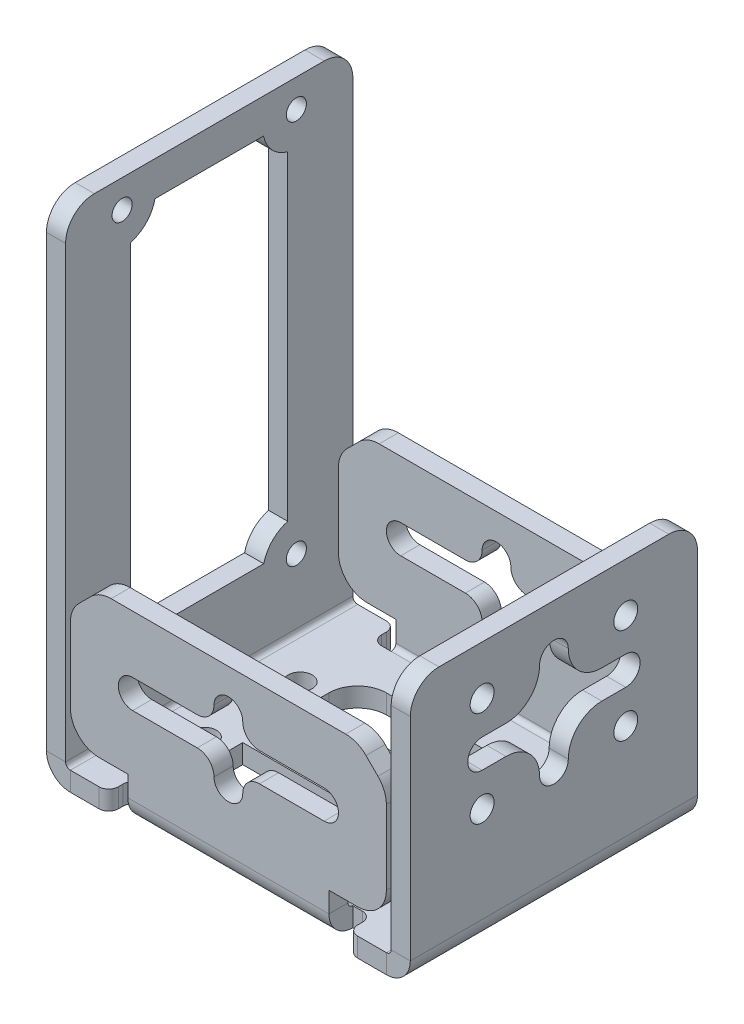
from build123d import *

# Parameters (mm, degrees)
BRIDA_BASE1_DEPTH               = 2
BRIDA_DE_ARISTA1_DEPTH          = 30
BRIDA_DE_ARISTA2_DEPTH          = 30
PLIEGUE_START                   = -16.5
PLIEGUE_CROQUIZADO2_OUTLINE_W   = 2
PLIEGUE_CROQUIZADO2_OUTLINE_H   = 15
PLIEGUE_CROQUIZADO2_DEPTH       = 33
PLIEGUE_START_2                 = -10.5
PLIEGUE_CROQUIZADO2_2_DEPTH     = 21
PLIEGUE_CROQUIZADO2_3_OUTLINE_W = 15
PLIEGUE_CROQUIZADO2_3_OUTLINE_H = 2
PLIEGUE_CROQUIZADO2_3_DEPTH     = 33
PLIEGUE_CROQUIZADO2_4_DEPTH     = 21
PLIEGUE_CROQUIZADO3_OUTLINE_W   = 2
PLIEGUE_CROQUIZADO3_OUTLINE_H   = 15
PLIEGUE_CROQUIZADO3_DEPTH       = 33
PLIEGUE_CROQUIZADO3_2_DEPTH     = 21
PLIEGUE_CROQUIZADO3_3_OUTLINE_W = 15
PLIEGUE_CROQUIZADO3_3_OUTLINE_H = 2
PLIEGUE_CROQUIZADO3_3_DEPTH     = 33
PLIEGUE_CROQUIZADO3_4_DEPTH     = 21
CROQUIS14_R                     = 1.05
CORTAR_EXTRUIR1_DEPTH           = 10
REDONDEO1_R                     = 3
CROQUIS15_R                     = 1.25
CORTAR_EXTRUIR2_DEPTH           = 2
CROQUIS16_R                     = 1.25
CORTAR_EXTRUIR3_DEPTH           = 2
CORTAR_EXTRUIR4_DEPTH           = 62.653548154


# Read off the part's stored shape, not the designer's step: Pliegue croquizado2, Pliegue croquizado3
# Sheet-metal steps are written as plain solids
with BuildPart() as part:
    # Croquis base → Brida base1 (new body)
    with BuildSketch(Plane(origin=(0, 0, 0), x_dir=(1, 0, 0), z_dir=(0, 1, 0))):
        with BuildLine():
            Line((-16.5, 15), (-16.5, -15))
            Line((-16.5, -15), (-13.5, -15))
            ThreePointArc((-13.5, -15), (-12.792893219, -14.707106781), (-12.5, -14))
            Line((-12.5, -14), (-12.5, -13.5))
            ThreePointArc((-12.5, -13.5), (-12.207106781, -12.792893219), (-11.5, -12.5))
            Line((-11.5, -12.5), (-10.5, -12.5))
            Line((-10.5, -12.5), (-10.5, -15))
            Line((-10.5, -15), (-10.5, -17))
            Line((-10.5, -17), (-16.5, -17))
            Line((-16.5, -17), (-16.5, -32))
            Line((-16.5, -32), (16.5, -32))
            Line((16.5, -32), (16.5, -17))
            Line((16.5, -17), (10.5, -17))
            Line((10.5, -17), (10.5, -15))
            Line((10.5, -15), (10.5, -12.5))
            Line((10.5, -12.5), (11.5, -12.5))
            ThreePointArc((11.5, -12.5), (12.207106781, -12.792893219), (12.5, -13.5))
            Line((12.5, -13.5), (12.5, -14))
            ThreePointArc((12.5, -14), (12.792893219, -14.707106781), (13.5, -15))
            Line((13.5, -15), (16.5, -15))
            Line((16.5, -15), (16.5, 15))
            Line((16.5, 15), (13.5, 15))
            ThreePointArc((13.5, 15), (12.792893219, 14.707106781), (12.5, 14))
            Line((12.5, 14), (12.5, 13.5))
            ThreePointArc((12.5, 13.5), (12.207106781, 12.792893219), (11.5, 12.5))
            Line((11.5, 12.5), (10.5, 12.5))
            Line((10.5, 12.5), (10.5, 15))
            Line((10.5, 15), (10.5, 17))
            Line((10.5, 17), (16.5, 17))
            Line((16.5, 17), (16.5, 32))
            Line((16.5, 32), (-16.5, 32))
            Line((-16.5, 32), (-16.5, 17))
            Line((-16.5, 17), (-10.5, 17))
            Line((-10.5, 17), (-10.5, 15))
            Line((-10.5, 15), (-10.5, 12.5))
            Line((-10.5, 12.5), (-11.5, 12.5))
            ThreePointArc((-11.5, 12.5), (-12.207106781, 12.792893219), (-12.5, 13.5))
            Line((-12.5, 13.5), (-12.5, 14))
            ThreePointArc((-12.5, 14), (-12.792893219, 14.707106781), (-13.5, 15))
            Line((-13.5, 15), (-16.5, 15))
        make_face()
    extrude(amount=-BRIDA_BASE1_DEPTH)

    # Brida de arista1 section (across the edge) → Brida de arista1 (add)
    with BuildSketch(Plane(origin=(-17, 0, -15), x_dir=(1, 0, 0), z_dir=(0, 0, 1))):
        with BuildLine():
            Line((-2, 0.5), (-2, 50.4))
            Line((-2, 50.4), (0, 50.4))
            Line((0, 50.4), (0, 0.5))
            ThreePointArc((0, 0.5), (0.146446609, 0.146446609), (0.5, 0))
            Line((0.5, 0), (0.5, -2))
            ThreePointArc((0.5, -2), (-1.267766953, -1.267766953), (-2, 0.5))
        make_face()
    extrude(amount=BRIDA_DE_ARISTA1_DEPTH)

    # Brida de arista2 section (across the edge) → Brida de arista2 (add)
    with BuildSketch(Plane(origin=(17, 0, 15), x_dir=(-1, 0, 0), z_dir=(0, 0, -1))):
        with BuildLine():
            Line((-2, 0.5), (-2, 25.6))
            Line((-2, 25.6), (0, 25.6))
            Line((0, 25.6), (0, 0.5))
            ThreePointArc((0, 0.5), (0.146446609, 0.146446609), (0.5, 0))
            Line((0.5, 0), (0.5, -2))
            ThreePointArc((0.5, -2), (-1.267766953, -1.267766953), (-2, 0.5))
        make_face()
    extrude(amount=BRIDA_DE_ARISTA2_DEPTH)

    # Pliegue croquizado2 outline → Pliegue croquizado2 (cut)
    with BuildSketch(Plane.YZ.offset(PLIEGUE_START)):
        with Locations((-1, -24.5)):
            Rectangle(PLIEGUE_CROQUIZADO2_OUTLINE_W, PLIEGUE_CROQUIZADO2_OUTLINE_H)
    extrude(amount=PLIEGUE_CROQUIZADO2_DEPTH, mode=Mode.SUBTRACT)

    # Pliegue croquizado2 2 outline → Pliegue croquizado2 2 (cut)
    with BuildSketch(Plane.YZ.offset(PLIEGUE_START_2)):
        with BuildLine():
            Line((0, -17), (0, -14.949489743))
            ThreePointArc((0, -14.949489743), (-1.436491673, -14.08113883), (-2, -12.5))
            Line((-2, -12.5), (-2, -17))
            Line((-2, -17), (0, -17))
        make_face()
    extrude(amount=PLIEGUE_CROQUIZADO2_2_DEPTH, mode=Mode.SUBTRACT)



with BuildPart() as body_2:
    # Pliegue croquizado2 3 outline → Pliegue croquizado2 3 (new body)
    with BuildSketch(Plane.YZ.offset(PLIEGUE_START)):
        with Locations((10.14380551, -14)):
            Rectangle(PLIEGUE_CROQUIZADO2_3_OUTLINE_W, PLIEGUE_CROQUIZADO2_3_OUTLINE_H)
    extrude(amount=PLIEGUE_CROQUIZADO2_3_DEPTH)


with BuildPart() as part_1:
    add(part.part)

    add(body_2.part)  # Pliegue croquizado2 4 merges body 2
    # Pliegue croquizado2 4 outline → Pliegue croquizado2 4 (add)
    with BuildSketch(Plane.YZ.offset(PLIEGUE_START_2)):
        with BuildLine():
            Line((0.5, -15), (2.64380551, -15))
            Line((2.64380551, -15), (2.64380551, -13))
            Line((2.64380551, -13), (0.5, -13))
            ThreePointArc((0.5, -13), (0.146446609, -12.853553391), (0, -12.5))
            Line((0, -12.5), (0, -14.949489743))
            ThreePointArc((0, -14.949489743), (0.248727595, -14.987340383), (0.5, -15))
        make_face()
    extrude(amount=PLIEGUE_CROQUIZADO2_4_DEPTH)

    # Pliegue croquizado3 outline → Pliegue croquizado3 (cut)
    with BuildSketch(Plane.YZ.offset(PLIEGUE_START)):
        with Locations((-1, 24.5)):
            Rectangle(PLIEGUE_CROQUIZADO3_OUTLINE_W, PLIEGUE_CROQUIZADO3_OUTLINE_H)
    extrude(amount=PLIEGUE_CROQUIZADO3_DEPTH, mode=Mode.SUBTRACT)

    # Pliegue croquizado3 2 outline → Pliegue croquizado3 2 (cut)
    with BuildSketch(Plane.YZ.offset(PLIEGUE_START_2)):
        with BuildLine():
            ThreePointArc((-2, 12.5), (-1.436491673, 14.08113883), (0, 14.949489743))
            Line((0, 14.949489743), (0, 17))
            Line((0, 17), (-2, 17))
            Line((-2, 17), (-2, 12.5))
        make_face()
    extrude(amount=PLIEGUE_CROQUIZADO3_2_DEPTH, mode=Mode.SUBTRACT)



with BuildPart() as body_2_2:
    # Pliegue croquizado3 3 outline → Pliegue croquizado3 3 (new body)
    with BuildSketch(Plane.YZ.offset(PLIEGUE_START)):
        with Locations((10.14380551, 14)):
            Rectangle(PLIEGUE_CROQUIZADO3_3_OUTLINE_W, PLIEGUE_CROQUIZADO3_3_OUTLINE_H)
    extrude(amount=PLIEGUE_CROQUIZADO3_3_DEPTH)


with BuildPart() as part_2:
    add(part_1.part)

    add(body_2_2.part)  # Pliegue croquizado3 4 merges body 2 2
    # Pliegue croquizado3 4 outline → Pliegue croquizado3 4 (add)
    with BuildSketch(Plane.YZ.offset(PLIEGUE_START_2)):
        with BuildLine():
            Line((2.64380551, 15), (0.5, 15))
            ThreePointArc((0.5, 15), (0.248727595, 14.987340383), (0, 14.949489743))
            Line((0, 14.949489743), (0, 12.5))
            ThreePointArc((0, 12.5), (0.146446609, 12.853553391), (0.5, 13))
            Line((0.5, 13), (2.64380551, 13))
            Line((2.64380551, 13), (2.64380551, 15))
        make_face()
    extrude(amount=PLIEGUE_CROQUIZADO3_4_DEPTH)

    # Croquis14 → Cortar-Extruir1 (cut)
    with BuildSketch(Plane.ZY.offset(19)):
        with BuildLine():
            Line((5.67071436, 46.7745), (-5.67071436, 46.7745))
            ThreePointArc((-5.67071436, 46.7745), (-6.553557163, 45.073327603), (-8.2, 44.092193095))
            Line((-8.2, 44.092193095), (-8.2, 10.656806905))
            ThreePointArc((-8.2, 10.656806905), (-6.588947931, 9.712658631), (-5.692654993, 8.0745))
            Line((-5.692654993, 8.0745), (5.692654993, 8.0745))
            ThreePointArc((5.692654993, 8.0745), (6.588947931, 9.712658631), (8.2, 10.656806905))
            Line((8.2, 10.656806905), (8.2, 44.092193095))
            ThreePointArc((8.2, 44.092193095), (6.553557163, 45.073327603), (5.67071436, 46.7745))
        make_face()
        with Locations(Location((-9.1, 47.4745, 0), (0, 0, 270))):
            Circle(CROQUIS14_R)
        with Locations(Location((9.1, 47.4745, 0), (0, 0, 270))):
            Circle(CROQUIS14_R)
        with Locations(Location((9.1, 7.2745, 0), (0, 0, 270))):
            Circle(CROQUIS14_R)
        with Locations(Location((-9.1, 7.2745, 0), (0, 0, 270))):
            Circle(CROQUIS14_R)
    extrude(amount=-CORTAR_EXTRUIR1_DEPTH, mode=Mode.SUBTRACT)

    # Redondeo1
    redondeo1_edges = [part_2.edges().sort_by_distance(p)[0] for p in [
        (-18, 50.4, -15),
        (-18, 50.4, 15),
    ]]
    fillet(redondeo1_edges, radius=REDONDEO1_R)

    # Croquis15 → Cortar-Extruir2 (cut)
    with BuildSketch(Plane.XZ.offset(2)):
        with BuildLine():
            Line((7, 8.5), (-7, 8.5))
            ThreePointArc((-7, 8.5), (-9.121320344, 7.621320344), (-10, 5.5))
            Line((-10, 5.5), (-10, 3.5))
            Line((-10, 3.5), (10, 3.5))
            Line((10, 3.5), (10, 5.5))
            ThreePointArc((10, 5.5), (9.121320344, 7.621320344), (7, 8.5))
        make_face()
        with BuildLine():
            Line((10, -3.5), (-10, -3.5))
            Line((-10, -3.5), (-10, -5.5))
            ThreePointArc((-10, -5.5), (-9.121320344, -7.621320344), (-7, -8.5))
            Line((-7, -8.5), (7, -8.5))
            ThreePointArc((7, -8.5), (9.121320344, -7.621320344), (10, -5.5))
            Line((10, -5.5), (10, -3.5))
        make_face()
        with Locations(Location((-12.5, 5, 0), (0, 0, 270))):
            Circle(CROQUIS15_R)
        with Locations(Location((-12.5, -5, 0), (0, 0, 270))):
            Circle(CROQUIS15_R)
        with Locations(Location((12.5, -5, 0), (0, 0, 270))):
            Circle(CROQUIS15_R)
        with Locations(Location((12.5, 5, 0), (0, 0, 270))):
            Circle(CROQUIS15_R)
    extrude(amount=-CORTAR_EXTRUIR2_DEPTH, mode=Mode.SUBTRACT)

    # Croquis16 → Cortar-Extruir3 (cut)
    with BuildSketch(Plane(origin=(19, 0, 0), x_dir=(0, 0, -1), z_dir=(1, 0, 0))):
        with BuildLine():
            ThreePointArc((-15, 22.6), (-14.121320344, 24.721320344), (-12, 25.6))
            Line((-12, 25.6), (-15, 25.6))
            Line((-15, 25.6), (-15, 22.6))
        make_face()
        with BuildLine():
            Line((15, 25.6), (12, 25.6))
            ThreePointArc((12, 25.6), (14.121320344, 24.721320344), (15, 22.6))
            Line((15, 22.6), (15, 25.6))
        make_face()
        with BuildLine():
            Line((-7.5, 17), (-5, 17))
            ThreePointArc((-5, 17), (-2.525126266, 18.025126266), (-1.5, 20.5))
            ThreePointArc((-1.5, 20.5), (0, 22), (1.5, 20.5))
            ThreePointArc((1.5, 20.5), (2.525126266, 18.025126266), (5, 17))
            Line((5, 17), (7.5, 17))
            ThreePointArc((7.5, 17), (9, 15.5), (7.5, 14))
            Line((7.5, 14), (5, 14))
            ThreePointArc((5, 14), (2.525126266, 12.974873734), (1.5, 10.5))
            ThreePointArc((1.5, 10.5), (0, 9), (-1.5, 10.5))
            ThreePointArc((-1.5, 10.5), (-2.525126266, 12.974873734), (-5, 14))
            Line((-5, 14), (-7.5, 14))
            ThreePointArc((-7.5, 14), (-9, 15.5), (-7.5, 17))
        make_face()
        with Locations(Location((-7.5, 20.5, 0), (0, 0, 90))):
            Circle(CROQUIS16_R)
        with Locations(Location((7.5, 20.5, 0), (0, 0, 90))):
            Circle(CROQUIS16_R)
        with Locations(Location((7.5, 10.5, 0), (0, 0, 90))):
            Circle(CROQUIS16_R)
        with Locations(Location((-7.5, 10.5, 0), (0, 0, 90))):
            Circle(CROQUIS16_R)
    extrude(amount=-CORTAR_EXTRUIR3_DEPTH, mode=Mode.SUBTRACT)

    # Croquis17 → Cortar-Extruir4 (cut, through all)
    with BuildSketch(Plane.XY.offset(15)):
        with BuildLine():
            Line((16.5, 2.64380551), (16.5, 5.64380551))
            ThreePointArc((16.5, 5.64380551), (15.621320344, 3.522485166), (13.5, 2.64380551))
            Line((13.5, 2.64380551), (16.5, 2.64380551))
        make_face()
        with BuildLine():
            ThreePointArc((-13.5, 2.64380551), (-15.621320344, 3.522485166), (-16.5, 5.64380551))
            Line((-16.5, 5.64380551), (-16.5, 2.64380551))
            Line((-16.5, 2.64380551), (-13.5, 2.64380551))
        make_face()
        with BuildLine():
            ThreePointArc((-16.5, 13.394258544), (-16.271638598, 14.542308841), (-15.621320344, 15.515578888))
            Line((-15.621320344, 15.515578888), (-14.371773378, 16.765125853))
            ThreePointArc((-14.371773378, 16.765125853), (-13.398503331, 17.415444107), (-12.250453034, 17.64380551))
            Line((-12.250453034, 17.64380551), (-16.5, 17.64380551))
            Line((-16.5, 17.64380551), (-16.5, 13.394258544))
        make_face()
        with BuildLine():
            Line((16.5, 17.64380551), (12.250453034, 17.64380551))
            ThreePointArc((12.250453034, 17.64380551), (13.398503331, 17.415444107), (14.371773378, 16.765125853))
            Line((14.371773378, 16.765125853), (15.621320344, 15.515578888))
            ThreePointArc((15.621320344, 15.515578888), (16.271638598, 14.542308841), (16.5, 13.394258544))
            Line((16.5, 13.394258544), (16.5, 17.64380551))
        make_face()
        with BuildLine():
            Line((-10, 11.64380551), (-3.250000035, 11.64380551))
            ThreePointArc((-3.250000035, 11.64380551), (-2.012563143, 12.156368618), (-1.5, 13.39380551))
            ThreePointArc((-1.5, 13.39380551), (0, 14.89380551), (1.5, 13.39380551))
            ThreePointArc((1.5, 13.39380551), (2.012563133, 12.156368643), (3.25, 11.64380551))
            Line((3.25, 11.64380551), (10, 11.64380551))
            ThreePointArc((10, 11.64380551), (11.5, 10.14380551), (10, 8.64380551))
            Line((10, 8.64380551), (3.25, 8.64380551))
            ThreePointArc((3.25, 8.64380551), (2.012563133, 8.131242377), (1.5, 6.89380551))
            ThreePointArc((1.5, 6.89380551), (0, 5.39380551), (-1.5, 6.89380551))
            ThreePointArc((-1.5, 6.89380551), (-2.012563133, 8.131242377), (-3.25, 8.64380551))
            Line((-3.25, 8.64380551), (-10, 8.64380551))
            ThreePointArc((-10, 8.64380551), (-11.5, 10.14380551), (-10, 11.64380551))
        make_face()
    extrude(amount=-CORTAR_EXTRUIR4_DEPTH, mode=Mode.SUBTRACT)


solid = part_2.part
